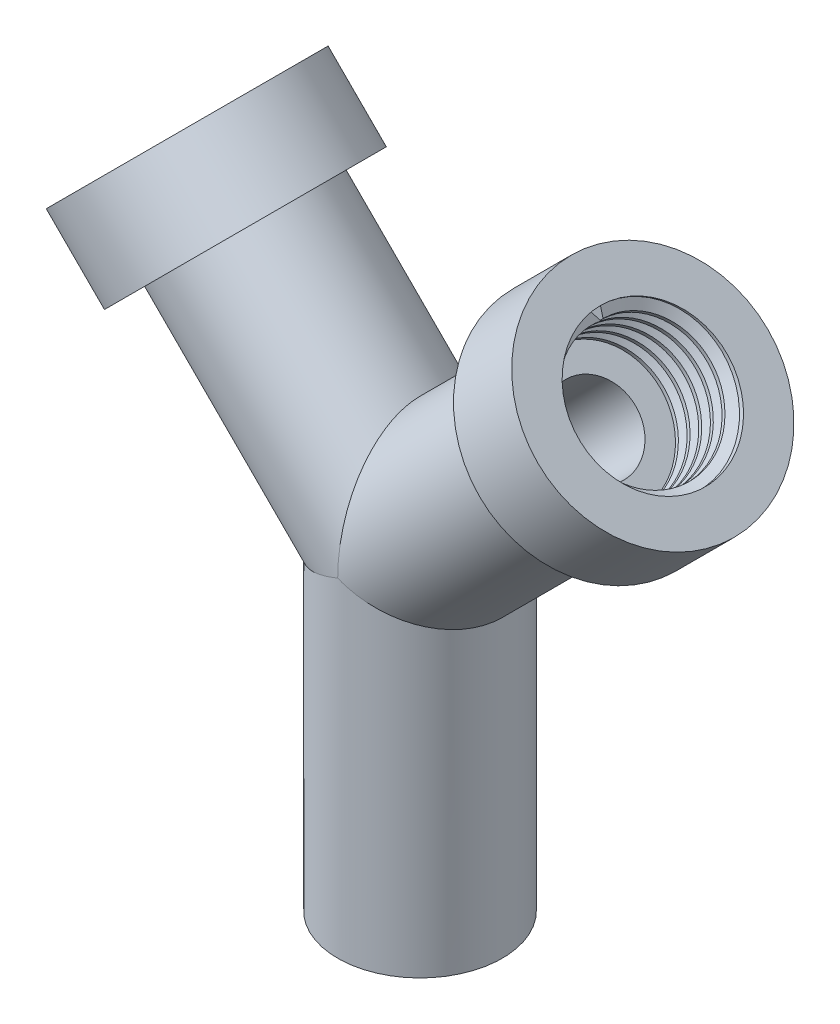
from build123d import *

# Parameters (mm, degrees)
SKETCH3_R          = 3.175
CUT_EXTRUDE1_DEPTH = 19.05
SKETCH4_R          = 3.175
CUT_EXTRUDE2_DEPTH = 25.4
THREAD1_PITCH      = 1.27
THREAD2_PITCH      = 1.27


with BuildPart() as part:
    # Sketch1 → Revolve1 (revolve)
    with BuildSketch(Plane.XY, mode=Mode.PRIVATE) as revolve1_sk:
        Polygon((13.470384181603752, 13.470384181603707), (9.429268927122632, 17.51149943608483), (13.919396987657207, 22.001627496619406), (11.674332957389915, 24.246691526886696), (7.184204896855344, 19.75656346635212), (8.980256121069173, 17.960512242138282), (-4.490128060534553, 4.490128060534555), (2.082e-14, -2.429e-14), align=None)
    revolve1 = revolve(revolve1_sk.sketch.rotate(Axis((2.082e-14, -2.429e-14, 0), (0.7071067811865475, 0.7071067811865476, 0)), 180), axis=Axis((2.082e-14, -2.429e-14, 0), (0.7071067811865475, 0.7071067811865476, 0)))

    # Mirror1: Revolve1 across plane
    add(revolve1.mirror(Plane(origin=(0, 0, 0), x_dir=(0, 0, 1), z_dir=(1, 0, 0))))

    # Sketch2 → Revolve2 (revolve)
    with BuildSketch(Plane.XY, mode=Mode.PRIVATE) as revolve2_sk:
        Polygon((-1.77e-15, 9e-16), (6.349999999999998, 0), (6.350000000000001, -25.4), (3.47e-15, -25.4), align=None)
    revolve(revolve2_sk.sketch.rotate(Axis((-1.77e-15, 9e-16, 0), (0, -1, 0)), 180), axis=Axis((-1.77e-15, 9e-16, 0), (0, -1, 0)))

    # Sketch3 → Cut-Extrude1 (cut)
    with BuildSketch(Plane(origin=(13.470384181603727, 13.470384181603729, 0), x_dir=(0, 0, -1), z_dir=(0.7071067811865475, 0.7071067811865476, 0))):
        with Locations(Location((0, -3.123e-14, 0), (0, 0, 90))):
            Circle(SKETCH3_R)
    cut_extrude1 = extrude(amount=-CUT_EXTRUDE1_DEPTH, mode=Mode.SUBTRACT)

    # Mirror2: Cut-Extrude1 across plane
    add(cut_extrude1.mirror(Plane(origin=(0, 0, 0), x_dir=(0, 0, 1), z_dir=(1, 0, 0))), mode=Mode.SUBTRACT)

    # Sketch4 → Cut-Extrude2 (cut)
    with BuildSketch(Plane.XZ.offset(25.4)):
        Circle(SKETCH4_R)
    extrude(amount=-CUT_EXTRUDE2_DEPTH, mode=Mode.SUBTRACT)

    # Thread1: the profile of Thread Profile1 profile screwed along a right-hand helix of 5 turns, 8 arcs to a turn; built about Z, then put on its axis
    thread1_z = Axis((0, 0, 0), (0, 0, 1))
    thread1_corners = [(5.7153, 0, -0.000173205), (5.7153, 0, 1.111423201), (5.027592339, 0, 0.714374998), (5.027592339, 0, 0.396874998)]
    with BuildLine(mode=Mode.PRIVATE) as thread1_profile:
        Line(thread1_corners[0], thread1_corners[1])
        Line(thread1_corners[1], thread1_corners[2])
        Line(thread1_corners[2], thread1_corners[3])
        Line(thread1_corners[3], thread1_corners[0])
    thread1_cap = Face(thread1_profile.wire())
    thread1_turn_angles = [0, 22.5, 45, 67.5, 90, 112.5, 135, 157.5, 180, 202.5, 225, 247.5, 270, 292.5, 315, 337.5, 360]
    thread1_turn_weights = [1, 0.9238795325112867, 1, 0.9238795325112867, 1, 0.9238795325112867, 1, 0.9238795325112867, 1, 0.9238795325112867, 1, 0.9238795325112867, 1, 0.9238795325112867, 1, 0.9238795325112867, 1]
    thread1_turn_rails = [Edge.make_bspline([Vector(p[0], p[1], 0).rotate(thread1_z, thread1_turn_angles[k]) / thread1_turn_weights[k] + Vector(0, 0, p[2] + THREAD1_PITCH * thread1_turn_angles[k] / 360) for k in range(17)], [0, 0, 0, 1, 1, 2, 2, 3, 3, 4, 4, 5, 5, 6, 6, 7, 7, 8, 8, 8], 2, thread1_turn_weights) for p in thread1_corners]
    thread1_turn_sides = [Face.make_surface_from_curves(thread1_turn_rails[p[0]], thread1_turn_rails[p[1]]) for p in [(0, 1), (1, 2), (2, 3), (3, 0)]]
    thread1 = Plane(origin=(-17.960512242, 17.960512242, 0), x_dir=(-0.707106781, -0.707106781, 0), z_dir=(0.707106781, -0.707106781, 0)) * Solid(Shell([*[p.moved(Location((0, 0, THREAD1_PITCH * i))) for i in range(5) for p in thread1_turn_sides], thread1_cap, thread1_cap.rotate(thread1_z, 1800).moved(Location((0, 0, THREAD1_PITCH * 1800 / 360)))]))
    add(thread1)

    # Thread2: the profile of Thread Profile2 profile screwed along a right-hand helix of 5 turns, 8 arcs to a turn; built about Z, then put on its axis
    thread2_z = Axis((0, 0, 0), (0, 0, 1))
    thread2_corners = [(5.7153, 0, -0.000173205), (5.7153, 0, 1.111423201), (5.027592339, 0, 0.714374998), (5.027592339, 0, 0.396874998)]
    with BuildLine(mode=Mode.PRIVATE) as thread2_profile:
        Line(thread2_corners[0], thread2_corners[1])
        Line(thread2_corners[1], thread2_corners[2])
        Line(thread2_corners[2], thread2_corners[3])
        Line(thread2_corners[3], thread2_corners[0])
    thread2_cap = Face(thread2_profile.wire())
    thread2_turn_angles = [0, 22.5, 45, 67.5, 90, 112.5, 135, 157.5, 180, 202.5, 225, 247.5, 270, 292.5, 315, 337.5, 360]
    thread2_turn_weights = [1, 0.9238795325112867, 1, 0.9238795325112867, 1, 0.9238795325112867, 1, 0.9238795325112867, 1, 0.9238795325112867, 1, 0.9238795325112867, 1, 0.9238795325112867, 1, 0.9238795325112867, 1]
    thread2_turn_rails = [Edge.make_bspline([Vector(p[0], p[1], 0).rotate(thread2_z, thread2_turn_angles[k]) / thread2_turn_weights[k] + Vector(0, 0, p[2] + THREAD2_PITCH * thread2_turn_angles[k] / 360) for k in range(17)], [0, 0, 0, 1, 1, 2, 2, 3, 3, 4, 4, 5, 5, 6, 6, 7, 7, 8, 8, 8], 2, thread2_turn_weights) for p in thread2_corners]
    thread2_turn_sides = [Face.make_surface_from_curves(thread2_turn_rails[p[0]], thread2_turn_rails[p[1]]) for p in [(0, 1), (1, 2), (2, 3), (3, 0)]]
    thread2 = Plane(origin=(17.960512242, 17.960512242, 0), x_dir=(-0.707106781, 0.707106781, 0), z_dir=(-0.707106781, -0.707106781, 0)) * Solid(Shell([*[p.moved(Location((0, 0, THREAD2_PITCH * i))) for i in range(5) for p in thread2_turn_sides], thread2_cap, thread2_cap.rotate(thread2_z, 1800).moved(Location((0, 0, THREAD2_PITCH * 1800 / 360)))]))
    add(thread2)


solid = part.part
